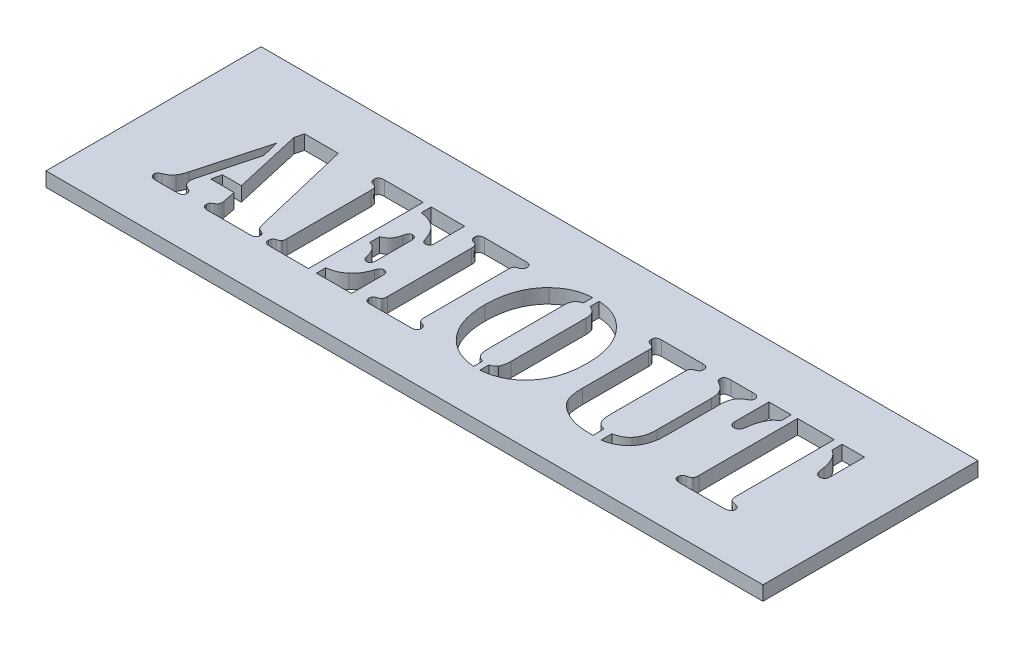
from build123d import *

# Parameters (mm, degrees)
SKETCH1_W           = 50
SKETCH1_H           = 15
BOSS_EXTRUDE1_DEPTH = 1
CUT_EXTRUDE1_REACH  = 28.12


with BuildPart() as part:
    # Sketch1 → Boss-Extrude1 (new body)
    with BuildSketch(Plane(origin=(0, 0, 0), x_dir=(1, 0, 0), z_dir=(0, 1, 0))):
        Rectangle(SKETCH1_W, SKETCH1_H)
    extrude(amount=BOSS_EXTRUDE1_DEPTH)

    # Sketch2 → Cut-Extrude1 (cut, up to next)
    with BuildSketch(Plane(origin=(0, 1, 0), x_dir=(1, 0, 0), z_dir=(0, 1, 0)), mode=Mode.PRIVATE) as cut_extrude1_sk1:
        with BuildLine():
            Line((-18.225694444, 3.752337343), (-15.864583333, 3.752337343))
            Line((-15.864583333, 3.752337343), (-14.223958333, -3.134815435))
            add(Edge.make_bspline(
                [(-14.223958333, -3.134815435), (-14.208128828, -3.191844267), (-14.1779416, -3.300599548), (-14.137358017, -3.405908631), (-14.118055556, -3.455995991)],
                knots=[0, 0, 0, 0, 1.048755183, 2, 2, 2, 2], degree=3))
            add(Edge.make_bspline(
                [(-14.118055556, -3.455995991), (-14.107397122, -3.474656334), (-14.085291097, -3.513358647), (-14.030830987, -3.560564799), (-13.963119074, -3.604018374), (-13.910156126, -3.626377605), (-13.881944444, -3.638287657)],
                knots=[0, 0, 0, 0, 0.840160251, 1.742526606, 2.797515595, 4, 4, 4, 4], degree=3))
            add(Edge.make_bspline(
                [(-13.881944444, -3.638287657), (-13.837688393, -3.657964025), (-13.761778239, -3.691713897), (-13.669036938, -3.758265826), (-13.616162585, -3.844705893), (-13.612860282, -3.908380036), (-13.611111111, -3.942107102)],
                knots=[0, 0, 0, 0, 1.326867952, 2.275909135, 3.086779591, 4, 4, 4, 4], degree=3))
            add(Edge.make_bspline(
                [(-13.611111111, -3.942107102), (-13.612166134, -3.96604148), (-13.614201414, -4.012214079), (-13.637720902, -4.076278339), (-13.675769286, -4.130979021), (-13.729398274, -4.17476108), (-13.797929776, -4.2076827), (-13.879981542, -4.231568272), (-13.977017745, -4.244713365), (-14.046256836, -4.246634121), (-14.083333333, -4.247662657)],
                knots=[0, 0, 0, 0, 0.899652897, 1.735550104, 2.535289427, 3.388132219, 4.315971308, 5.386976564, 6.600765056, 8, 8, 8, 8], degree=3))
            Line((-14.083333333, -4.247662657), (-17.006944444, -4.247662657))
            add(Edge.make_bspline(
                [(-17.006944444, -4.247662657), (-17.034261849, -4.246919978), (-17.087186601, -4.24548111), (-17.161353932, -4.227331168), (-17.228397515, -4.201383662), (-17.285342546, -4.163525658), (-17.331203502, -4.115886242), (-17.365426728, -4.061173841), (-17.384814546, -3.998328838), (-17.387501078, -3.954388943), (-17.388888889, -3.931690435)],
                knots=[0, 0, 0, 0, 1.175318829, 2.277063206, 3.273429624, 4.263211015, 5.198644873, 6.106027898, 7.021610334, 8, 8, 8, 8], degree=3))
            add(Edge.make_bspline(
                [(-17.388888889, -3.931690435), (-17.387792838, -3.896629486), (-17.385842282, -3.834234242), (-17.355488119, -3.760997814), (-17.314163488, -3.716177105), (-17.268869611, -3.682149905), (-17.212493223, -3.641765362), (-17.168123739, -3.616984512), (-17.144097222, -3.603565435)],
                knots=[0, 0, 0, 0, 1.432553572, 2.549404146, 3.155101411, 3.915709373, 4.871335893, 6, 6, 6, 6], degree=3))
            add(Edge.make_bspline(
                [(-17.144097222, -3.603565435), (-17.111697795, -3.583687885), (-17.05336182, -3.547897861), (-16.986135723, -3.475601107), (-16.948113104, -3.388804261), (-16.945720429, -3.326191933), (-16.944444444, -3.292801546)],
                knots=[0, 0, 0, 0, 1.161992046, 2.092195629, 2.982591342, 4, 4, 4, 4], degree=3))
            add(Edge.make_bspline(
                [(-16.944444444, -3.292801546), (-16.944687965, -3.260889836), (-16.945146119, -3.200851902), (-16.955308589, -3.141695398), (-16.960069444, -3.113982102)],
                knots=[0, 0, 0, 0, 1.063051602, 2, 2, 2, 2], degree=3))
            Line((-16.960069444, -3.113982102), (-17.130208333, -2.247662657))
            Line((-17.130208333, -2.247662657), (-18.763888889, -2.247662657))
            Line((-18.763888889, -2.247662657), (-18.605902778, -1.580995991))
            Line((-18.605902778, -1.580995991), (-17.293402778, -1.580995991))
            Line((-17.293402778, -1.580995991), (-18.371527778, 3.169004009))
            Line((-18.371527778, 3.169004009), (-18.225694444, 3.752337343))
        make_face()
    cut_extrude1_tool1 = extrude(cut_extrude1_sk1.sketch, amount=-CUT_EXTRUDE1_REACH, mode=Mode.PRIVATE) & part.part
    # Sketch2 → Cut-Extrude1 (cut, up to next)
    with BuildSketch(Plane(origin=(0, 1, 0), x_dir=(1, 0, 0), z_dir=(0, 1, 0)), mode=Mode.PRIVATE) as cut_extrude1_sk2:
        with BuildLine():
            Line((-18.630208333, 2.241920676), (-18.331597222, 1.023170676))
            Line((-18.331597222, 1.023170676), (-19.34375, -2.744190435))
            add(Edge.make_bspline(
                [(-19.34375, -2.744190435), (-19.356460788, -2.796022226), (-19.380819369, -2.895351151), (-19.386278459, -2.997451428), (-19.388888889, -3.046273769)],
                knots=[0, 0, 0, 0, 1.043639418, 2, 2, 2, 2], degree=3))
            add(Edge.make_bspline(
                [(-19.388888889, -3.046273769), (-19.385926088, -3.103666098), (-19.380268524, -3.213258617), (-19.317470176, -3.362867313), (-19.218609906, -3.488795702), (-19.127257324, -3.54264226), (-19.079861111, -3.570579324)],
                knots=[0, 0, 0, 0, 1.065909191, 2.035388236, 2.980705811, 4, 4, 4, 4], degree=3))
            Line((-19.079861111, -3.570579324), (-18.895833333, -3.664329324))
            add(Edge.make_bspline(
                [(-18.895833333, -3.664329324), (-18.869241129, -3.680263511), (-18.818545475, -3.710640608), (-18.76099582, -3.779513044), (-18.727210262, -3.863412668), (-18.72392285, -3.924430526), (-18.722222222, -3.955995991)],
                knots=[0, 0, 0, 0, 1.03129857, 1.96607825, 2.947821365, 4, 4, 4, 4], degree=3))
            add(Edge.make_bspline(
                [(-18.722222222, -3.955995991), (-18.722771832, -3.978743059), (-18.723823559, -4.022271544), (-18.744235563, -4.082521181), (-18.774090868, -4.134123338), (-18.815171542, -4.178294846), (-18.87097172, -4.208431843), (-18.936579975, -4.231281162), (-19.013943866, -4.244761811), (-19.069391953, -4.246653799), (-19.098958333, -4.247662657)],
                knots=[0, 0, 0, 0, 1.001089615, 1.915671698, 2.776004461, 3.626767041, 4.544209435, 5.547912865, 6.692482548, 8, 8, 8, 8], degree=3))
            Line((-19.098958333, -4.247662657), (-20.586805556, -4.247662657))
            add(Edge.make_bspline(
                [(-20.586805556, -4.247662657), (-20.621039026, -4.246928296), (-20.686526818, -4.24552348), (-20.778824, -4.227776092), (-20.860798396, -4.200378905), (-20.930068661, -4.161063936), (-20.986256718, -4.111053207), (-21.02701359, -4.051695525), (-21.050260512, -3.982475383), (-21.053746987, -3.934175833), (-21.055555556, -3.909120991)],
                knots=[0, 0, 0, 0, 1.263225168, 2.41651886, 3.457937625, 4.444571192, 5.337806274, 6.215550556, 7.074337118, 8, 8, 8, 8], degree=3))
            add(Edge.make_bspline(
                [(-21.055555556, -3.909120991), (-21.052548897, -3.881178015), (-21.046318264, -3.823272382), (-20.990908691, -3.745876531), (-20.907154023, -3.678774154), (-20.837192074, -3.645964232), (-20.798611111, -3.627870991)],
                knots=[0, 0, 0, 0, 0.824400861, 1.708388363, 2.736276122, 4, 4, 4, 4], degree=3))
            add(Edge.make_bspline(
                [(-20.798611111, -3.627870991), (-20.760860497, -3.611393073), (-20.689902515, -3.580420338), (-20.592654058, -3.532585119), (-20.512542357, -3.485342809), (-20.423204393, -3.426106486), (-20.323959349, -3.336761289), (-20.258498117, -3.252298051), (-20.223958333, -3.207732102)],
                knots=[0, 0, 0, 0, 1.026075952, 1.928664772, 2.697596979, 3.341335493, 4.597189607, 6, 6, 6, 6], degree=3))
            add(Edge.make_bspline(
                [(-20.223958333, -3.207732102), (-20.197010421, -3.164830554), (-20.140708623, -3.075197109), (-20.071030349, -2.924348207), (-20.005592556, -2.75543594), (-19.972271372, -2.634019306), (-19.954861111, -2.570579324)],
                knots=[0, 0, 0, 0, 0.874304226, 1.826668352, 2.864437965, 4, 4, 4, 4], degree=3))
            Line((-19.954861111, -2.570579324), (-18.630208333, 2.241920676))
        make_face()
    cut_extrude1_tool2 = extrude(cut_extrude1_sk2.sketch, amount=-CUT_EXTRUDE1_REACH, mode=Mode.PRIVATE) & part.part
    # Sketch2 → Cut-Extrude1 (cut, up to next)
    with BuildSketch(Plane(origin=(0, 1, 0), x_dir=(1, 0, 0), z_dir=(0, 1, 0)), mode=Mode.PRIVATE) as cut_extrude1_sk3:
        with BuildLine():
            Line((-9.944444444, 3.752337343), (-9.944444444, -4.247662657))
            Line((-9.944444444, -4.247662657), (-12.505208333, -4.247662657))
            Line((-12.505208333, -4.247662657), (-12.657986111, -4.247662657))
            add(Edge.make_bspline(
                [(-12.657986111, -4.247662657), (-12.688143193, -4.246664796), (-12.744762942, -4.244791317), (-12.824941968, -4.230915759), (-12.89496513, -4.207581486), (-12.953183411, -4.172182081), (-13.000888301, -4.128326963), (-13.031173102, -4.073084816), (-13.052092292, -4.011289533), (-13.054356757, -3.967189564), (-13.055555556, -3.943843213)],
                knots=[0, 0, 0, 0, 1.275809178, 2.395324508, 3.433364274, 4.378530456, 5.262016052, 6.140052186, 7.015350866, 8, 8, 8, 8], degree=3))
            add(Edge.make_bspline(
                [(-13.055555556, -3.943843213), (-13.053193602, -3.906949739), (-13.048750854, -3.83755445), (-13.00707405, -3.742868654), (-12.93423973, -3.670545575), (-12.871613258, -3.643754728), (-12.838541667, -3.629607102)],
                knots=[0, 0, 0, 0, 1.074896783, 2.021841926, 2.955380476, 4, 4, 4, 4], degree=3))
            add(Edge.make_bspline(
                [(-12.838541667, -3.629607102), (-12.811303725, -3.619882689), (-12.763718359, -3.602893897), (-12.702116774, -3.579379269), (-12.658900449, -3.564371926), (-12.623885908, -3.550885393), (-12.592021729, -3.525409853), (-12.575478532, -3.498968126), (-12.565972222, -3.483773769)],
                knots=[0, 0, 0, 0, 1.641128884, 2.867093284, 3.73955991, 4.239698614, 4.988468111, 6, 6, 6, 6], degree=3))
            add(Edge.make_bspline(
                [(-12.565972222, -3.483773769), (-12.555332805, -3.466197289), (-12.532414193, -3.42833539), (-12.513466583, -3.359193878), (-12.500995269, -3.277659569), (-12.500349778, -3.218795774), (-12.5, -3.186898769)],
                knots=[0, 0, 0, 0, 0.795728394, 1.714096871, 2.761318972, 4, 4, 4, 4], degree=3))
            Line((-12.5, -3.186898769), (-12.5, 2.67074012))
            add(Edge.make_bspline(
                [(-12.5, 2.67074012), (-12.500424065, 2.703200026), (-12.501215224, 2.763759094), (-12.51296161, 2.847192864), (-12.532833177, 2.917739985), (-12.55537144, 2.956383664), (-12.565972222, 2.974559565)],
                knots=[0, 0, 0, 0, 1.234380862, 2.302932019, 3.201790819, 4, 4, 4, 4], degree=3))
            add(Edge.make_bspline(
                [(-12.565972222, 2.974559565), (-12.575483595, 2.989740572), (-12.592035603, 3.016159066), (-12.623852028, 3.041760524), (-12.659199933, 3.054949733), (-12.701606165, 3.072666363), (-12.763844302, 3.095084235), (-12.811349572, 3.112283895), (-12.838541667, 3.122129009)],
                knots=[0, 0, 0, 0, 1.009569614, 1.75688657, 2.256055053, 3.138468602, 4.362054748, 6, 6, 6, 6], degree=3))
            add(Edge.make_bspline(
                [(-12.838541667, 3.122129009), (-12.871801909, 3.136091116), (-12.935557287, 3.162854584), (-13.006590806, 3.239066523), (-13.048844372, 3.335231949), (-13.053226552, 3.405803045), (-13.055555556, 3.443309565)],
                knots=[0, 0, 0, 0, 1.03007389, 1.974512116, 2.923511095, 4, 4, 4, 4], degree=3))
            add(Edge.make_bspline(
                [(-13.055555556, 3.443309565), (-13.054328704, 3.467217355), (-13.05200922, 3.512417369), (-13.0315862, 3.575588307), (-13.000839034, 3.631222049), (-12.953238635, 3.675245873), (-12.894605898, 3.71011003), (-12.825355701, 3.736155963), (-12.74469749, 3.749286745), (-12.688120446, 3.751277185), (-12.657986111, 3.752337343)],
                knots=[0, 0, 0, 0, 1.002003185, 1.894384998, 2.766311233, 3.643649008, 4.582238159, 5.621343591, 6.733068665, 8, 8, 8, 8], degree=3))
            Line((-12.657986111, 3.752337343), (-12.505208333, 3.752337343))
            Line((-12.505208333, 3.752337343), (-9.944444444, 3.752337343))
        make_face()
    cut_extrude1_tool3 = extrude(cut_extrude1_sk3.sketch, amount=-CUT_EXTRUDE1_REACH, mode=Mode.PRIVATE) & part.part
    # Sketch2 → Cut-Extrude1 (cut, up to next)
    with BuildSketch(Plane(origin=(0, 1, 0), x_dir=(1, 0, 0), z_dir=(0, 1, 0)), mode=Mode.PRIVATE) as cut_extrude1_sk4:
        with BuildLine():
            Line((-9.388888889, 3.752337343), (-7.055555556, 3.752337343))
            Line((-7.055555556, 3.752337343), (-7.055555556, 1.646434565))
            add(Edge.make_bspline(
                [(-7.055555556, 1.646434565), (-7.055669567, 1.618544656), (-7.055880387, 1.566973429), (-7.071223359, 1.496087701), (-7.090260791, 1.435351653), (-7.122426428, 1.387027877), (-7.164331142, 1.350182432), (-7.216402946, 1.326689704), (-7.277334945, 1.309975431), (-7.321619833, 1.308622193), (-7.345486111, 1.307892898)],
                knots=[0, 0, 0, 0, 1.297100046, 2.398467488, 3.37194797, 4.248080405, 5.071011418, 5.940462097, 6.890061477, 8, 8, 8, 8], degree=3))
            add(Edge.make_bspline(
                [(-7.345486111, 1.307892898), (-7.382088862, 1.310144587), (-7.447045154, 1.314140498), (-7.525089124, 1.346616979), (-7.5615549, 1.397228037), (-7.590091978, 1.445024255), (-7.61688211, 1.507059526), (-7.632337925, 1.553712116), (-7.640625, 1.578726231)],
                knots=[0, 0, 0, 0, 1.496408907, 2.655570162, 3.259085196, 3.998612629, 4.926899124, 6, 6, 6, 6], degree=3))
            add(Edge.make_bspline(
                [(-7.640625, 1.578726231), (-7.679101718, 1.687438169), (-7.752934914, 1.896046133), (-7.901792924, 2.181290392), (-8.077461827, 2.425123302), (-8.281051934, 2.629636566), (-8.513130684, 2.795363033), (-8.777344862, 2.920718499), (-9.071384994, 3.012555062), (-9.280623281, 3.041289041), (-9.388888889, 3.056156787)],
                knots=[0, 0, 0, 0, 1.130832012, 2.169960077, 3.145894403, 4.069657363, 4.990096479, 5.930045021, 6.928948727, 8, 8, 8, 8], degree=3))
            Line((-9.388888889, 3.056156787), (-9.388888889, 3.752337343))
        make_face()
    cut_extrude1_tool4 = extrude(cut_extrude1_sk4.sketch, amount=-CUT_EXTRUDE1_REACH, mode=Mode.PRIVATE) & part.part
    # Sketch2 → Cut-Extrude1 (cut, up to next)
    with BuildSketch(Plane(origin=(0, 1, 0), x_dir=(1, 0, 0), z_dir=(0, 1, 0)), mode=Mode.PRIVATE) as cut_extrude1_sk5:
        with BuildLine():
            Line((-9.388888889, -0.534120991), (-9.388888889, 0.141226231))
            add(Edge.make_bspline(
                [(-9.388888889, 0.141226231), (-9.337663562, 0.169012539), (-9.239745776, 0.222126376), (-9.104642667, 0.306874839), (-8.994479143, 0.40095336), (-8.900277875, 0.49734002), (-8.825986528, 0.608310942), (-8.76156496, 0.731334748), (-8.709662221, 0.871611583), (-8.684785362, 0.971389076), (-8.671875, 1.023170676)],
                knots=[0, 0, 0, 0, 1.180986571, 2.257469038, 3.222785507, 4.110265038, 4.978639913, 5.917385587, 6.919184056, 8, 8, 8, 8], degree=3))
            add(Edge.make_bspline(
                [(-8.671875, 1.023170676), (-8.664441851, 1.058069157), (-8.650789917, 1.122164703), (-8.622455961, 1.208630571), (-8.592887843, 1.278436433), (-8.556640876, 1.33259004), (-8.513484775, 1.371893933), (-8.463999016, 1.400692582), (-8.406017826, 1.416419717), (-8.365255173, 1.418111483), (-8.34375, 1.419004009)],
                knots=[0, 0, 0, 0, 1.505392146, 2.764846178, 3.836585285, 4.697326174, 5.492824879, 6.280783141, 7.092991927, 8, 8, 8, 8], degree=3))
            add(Edge.make_bspline(
                [(-8.34375, 1.419004009), (-8.31563229, 1.417896416), (-8.262191812, 1.415791327), (-8.190134354, 1.384714698), (-8.132135351, 1.334961595), (-8.108060143, 1.290949197), (-8.095486111, 1.267962343)],
                knots=[0, 0, 0, 0, 1.085852217, 2.06376913, 2.988742716, 4, 4, 4, 4], degree=3))
            add(Edge.make_bspline(
                [(-8.095486111, 1.267962343), (-8.089102873, 1.25075223), (-8.073726289, 1.209294787), (-8.0649093, 1.131517327), (-8.054893485, 1.030391616), (-8.055318882, 0.954360403), (-8.055555556, 0.912059565)],
                knots=[0, 0, 0, 0, 0.609895254, 1.469176849, 2.591947466, 4, 4, 4, 4], degree=3))
            Line((-8.055555556, 0.912059565), (-8.055555556, -1.308426546))
            add(Edge.make_bspline(
                [(-8.055555556, -1.308426546), (-8.056167113, -1.351260959), (-8.057293263, -1.430138161), (-8.066480582, -1.538494172), (-8.084857116, -1.625495974), (-8.110040824, -1.694197657), (-8.148478957, -1.744194256), (-8.198656301, -1.779082379), (-8.261174674, -1.800008749), (-8.307119316, -1.802102648), (-8.331597222, -1.803218213)],
                knots=[0, 0, 0, 0, 1.58411055, 2.917051989, 4.012593196, 4.866950163, 5.598911493, 6.305405458, 7.097171608, 8, 8, 8, 8], degree=3))
            add(Edge.make_bspline(
                [(-8.331597222, -1.803218213), (-8.371352522, -1.799775024), (-8.447235194, -1.79320286), (-8.529637331, -1.736486357), (-8.574249419, -1.670847199), (-8.604821291, -1.607984142), (-8.633160699, -1.531923128), (-8.647026731, -1.475854411), (-8.654513889, -1.445579324)],
                knots=[0, 0, 0, 0, 1.342036637, 2.56160375, 3.240040044, 4.033620071, 4.938225671, 6, 6, 6, 6], degree=3))
            add(Edge.make_bspline(
                [(-8.654513889, -1.445579324), (-8.670496289, -1.381495148), (-8.70103125, -1.259059983), (-8.766150056, -1.091010523), (-8.837561431, -0.94414316), (-8.924135219, -0.822473526), (-9.021373899, -0.721331324), (-9.1301855, -0.638090293), (-9.25384843, -0.574447183), (-9.343226627, -0.547756794), (-9.388888889, -0.534120991)],
                knots=[0, 0, 0, 0, 1.278531199, 2.442680666, 3.485773606, 4.434753066, 5.322955403, 6.195374153, 7.078038041, 8, 8, 8, 8], degree=3))
        make_face()
    cut_extrude1_tool5 = extrude(cut_extrude1_sk5.sketch, amount=-CUT_EXTRUDE1_REACH, mode=Mode.PRIVATE) & part.part
    # Sketch2 → Cut-Extrude1 (cut, up to next)
    with BuildSketch(Plane(origin=(0, 1, 0), x_dir=(1, 0, 0), z_dir=(0, 1, 0)), mode=Mode.PRIVATE) as cut_extrude1_sk6:
        with BuildLine():
            Line((-9.388888889, -4.247662657), (-9.388888889, -3.601829324))
            add(Edge.make_bspline(
                [(-9.388888889, -3.601829324), (-9.328033322, -3.591350976), (-9.211008251, -3.571201143), (-9.044206003, -3.533981585), (-8.894426509, -3.488061771), (-8.756679237, -3.438362448), (-8.629526986, -3.372942752), (-8.502986676, -3.29802069), (-8.3773169, -3.208133556), (-8.29642167, -3.140008777), (-8.255208333, -3.105301546)],
                knots=[0, 0, 0, 0, 1.178424117, 2.266106011, 3.258322885, 4.167001624, 5.056005255, 5.982165939, 6.971982955, 8, 8, 8, 8], degree=3))
            add(Edge.make_bspline(
                [(-8.255208333, -3.105301546), (-8.177009754, -3.032324578), (-8.027712197, -2.892996176), (-7.874612383, -2.689183423), (-7.773828925, -2.51541869), (-7.70295545, -2.367371088), (-7.631660786, -2.202144093), (-7.589578191, -2.083583063), (-7.567708333, -2.021968213)],
                knots=[0, 0, 0, 0, 1.478913818, 2.823557948, 3.509390326, 4.258413643, 5.094916917, 6, 6, 6, 6], degree=3))
            add(Edge.make_bspline(
                [(-7.567708333, -2.021968213), (-7.557073747, -1.992322384), (-7.537431592, -1.937566334), (-7.5051396, -1.863659638), (-7.470559621, -1.805951792), (-7.424508077, -1.748103256), (-7.345774263, -1.700067023), (-7.275054495, -1.694851242), (-7.237847222, -1.692107102)],
                knots=[0, 0, 0, 0, 1.119865357, 2.068399023, 2.86239926, 3.505232302, 4.687446157, 6, 6, 6, 6], degree=3))
            add(Edge.make_bspline(
                [(-7.237847222, -1.692107102), (-7.21232285, -1.693620145), (-7.164656008, -1.696445757), (-7.098178772, -1.712299176), (-7.045385997, -1.745158163), (-7.004538366, -1.79143868), (-6.977684976, -1.854024198), (-6.956887466, -1.931639231), (-6.945738072, -2.027451338), (-6.944897939, -2.097177841), (-6.944444444, -2.134815435)],
                knots=[0, 0, 0, 0, 0.999578033, 1.866714988, 2.638932701, 3.392362113, 4.242509345, 5.27434009, 6.528718957, 8, 8, 8, 8], degree=3))
            Line((-6.944444444, -2.134815435), (-6.944444444, -4.247662657))
            Line((-6.944444444, -4.247662657), (-9.388888889, -4.247662657))
        make_face()
    cut_extrude1_tool6 = extrude(cut_extrude1_sk6.sketch, amount=-CUT_EXTRUDE1_REACH, mode=Mode.PRIVATE) & part.part
    # Sketch2 → Cut-Extrude1 (cut, up to next)
    with BuildSketch(Plane(origin=(0, 1, 0), x_dir=(1, 0, 0), z_dir=(0, 1, 0)), mode=Mode.PRIVATE) as cut_extrude1_sk7:
        with BuildLine():
            Line((-2.939236111, -4.247662657), (-5.505208333, -4.247662657))
            Line((-5.505208333, -4.247662657), (-5.657986111, -4.247662657))
            add(Edge.make_bspline(
                [(-5.657986111, -4.247662657), (-5.688143193, -4.246664796), (-5.744762942, -4.244791317), (-5.824941968, -4.230915759), (-5.89496513, -4.207581486), (-5.953183411, -4.172182081), (-6.000888301, -4.128326963), (-6.031173102, -4.073084816), (-6.052092292, -4.011289533), (-6.054356757, -3.967189564), (-6.055555556, -3.943843213)],
                knots=[0, 0, 0, 0, 1.275809178, 2.395324508, 3.433364274, 4.378530456, 5.262016052, 6.140052186, 7.015350866, 8, 8, 8, 8], degree=3))
            add(Edge.make_bspline(
                [(-6.055555556, -3.943843213), (-6.053193602, -3.906949739), (-6.048750854, -3.83755445), (-6.00707405, -3.742868654), (-5.93423973, -3.670545575), (-5.871613258, -3.643754728), (-5.838541667, -3.629607102)],
                knots=[0, 0, 0, 0, 1.074896783, 2.021841926, 2.955380476, 4, 4, 4, 4], degree=3))
            add(Edge.make_bspline(
                [(-5.838541667, -3.629607102), (-5.811303725, -3.619882689), (-5.763718359, -3.602893897), (-5.702116774, -3.579379269), (-5.658900449, -3.564371926), (-5.623885908, -3.550885393), (-5.592021729, -3.525409853), (-5.575478532, -3.498968126), (-5.565972222, -3.483773769)],
                knots=[0, 0, 0, 0, 1.641128884, 2.867093284, 3.73955991, 4.239698614, 4.988468111, 6, 6, 6, 6], degree=3))
            add(Edge.make_bspline(
                [(-5.565972222, -3.483773769), (-5.555332805, -3.466197289), (-5.532414193, -3.42833539), (-5.513466583, -3.359193878), (-5.500995269, -3.277659569), (-5.500349778, -3.218795774), (-5.5, -3.186898769)],
                knots=[0, 0, 0, 0, 0.795728394, 1.714096871, 2.761318972, 4, 4, 4, 4], degree=3))
            Line((-5.5, -3.186898769), (-5.5, 2.67074012))
            add(Edge.make_bspline(
                [(-5.5, 2.67074012), (-5.500424065, 2.703200026), (-5.501215224, 2.763759094), (-5.51296161, 2.847192864), (-5.532833177, 2.917739985), (-5.55537144, 2.956383664), (-5.565972222, 2.974559565)],
                knots=[0, 0, 0, 0, 1.234380862, 2.302932019, 3.201790819, 4, 4, 4, 4], degree=3))
            add(Edge.make_bspline(
                [(-5.565972222, 2.974559565), (-5.575483595, 2.989740572), (-5.592035603, 3.016159066), (-5.623852028, 3.041760524), (-5.659199933, 3.054949733), (-5.701606165, 3.072666363), (-5.763844302, 3.095084235), (-5.811349572, 3.112283895), (-5.838541667, 3.122129009)],
                knots=[0, 0, 0, 0, 1.009569614, 1.75688657, 2.256055053, 3.138468602, 4.362054748, 6, 6, 6, 6], degree=3))
            add(Edge.make_bspline(
                [(-5.838541667, 3.122129009), (-5.871801909, 3.136091116), (-5.935557287, 3.162854584), (-6.006590806, 3.239066523), (-6.048844372, 3.335231949), (-6.053226552, 3.405803045), (-6.055555556, 3.443309565)],
                knots=[0, 0, 0, 0, 1.03007389, 1.974512116, 2.923511095, 4, 4, 4, 4], degree=3))
            add(Edge.make_bspline(
                [(-6.055555556, 3.443309565), (-6.054328704, 3.467217355), (-6.05200922, 3.512417369), (-6.0315862, 3.575588307), (-6.000839034, 3.631222049), (-5.953238635, 3.675245873), (-5.894605898, 3.71011003), (-5.825355701, 3.736155963), (-5.74469749, 3.749286745), (-5.688120446, 3.751277185), (-5.657986111, 3.752337343)],
                knots=[0, 0, 0, 0, 1.002003185, 1.894384998, 2.766311233, 3.643649008, 4.582238159, 5.621343591, 6.733068665, 8, 8, 8, 8], degree=3))
            Line((-5.657986111, 3.752337343), (-5.505208333, 3.752337343))
            Line((-5.505208333, 3.752337343), (-2.939236111, 3.752337343))
            Line((-2.939236111, 3.752337343), (-2.786458333, 3.752337343))
            add(Edge.make_bspline(
                [(-2.786458333, 3.752337343), (-2.756335548, 3.751248786), (-2.699780188, 3.749205026), (-2.619515239, 3.736514149), (-2.551209673, 3.709644803), (-2.492787581, 3.675369077), (-2.445612006, 3.63071419), (-2.412495338, 3.576148005), (-2.392565872, 3.512338372), (-2.390160938, 3.467190026), (-2.388888889, 3.443309565)],
                knots=[0, 0, 0, 0, 1.268560657, 2.381715452, 3.39938894, 4.339185152, 5.217651218, 6.10317875, 6.996708201, 8, 8, 8, 8], degree=3))
            add(Edge.make_bspline(
                [(-2.388888889, 3.443309565), (-2.391217892, 3.405803045), (-2.395600072, 3.335231949), (-2.437853638, 3.239066523), (-2.508887157, 3.162854584), (-2.572642536, 3.136091116), (-2.605902778, 3.122129009)],
                knots=[0, 0, 0, 0, 1.076488905, 2.025487884, 2.96992611, 4, 4, 4, 4], degree=3))
            add(Edge.make_bspline(
                [(-2.605902778, 3.122129009), (-2.633108255, 3.112323923), (-2.680636906, 3.095194192), (-2.743251426, 3.072202444), (-2.786443889, 3.055153026), (-2.822057249, 3.042101945), (-2.85235035, 3.015396386), (-2.868850508, 2.989601374), (-2.878472222, 2.974559565)],
                knots=[0, 0, 0, 0, 1.636602956, 2.859186374, 3.771360974, 4.270120389, 4.991257728, 6, 6, 6, 6], degree=3))
            add(Edge.make_bspline(
                [(-2.878472222, 2.974559565), (-2.889256679, 2.956433734), (-2.912101279, 2.918037979), (-2.928610034, 2.846662772), (-2.944134899, 2.764020836), (-2.944336529, 2.703260101), (-2.944444444, 2.67074012)],
                knots=[0, 0, 0, 0, 0.798774196, 1.692034923, 2.764745377, 4, 4, 4, 4], degree=3))
            Line((-2.944444444, 2.67074012), (-2.944444444, -3.186898769))
            add(Edge.make_bspline(
                [(-2.944444444, -3.186898769), (-2.944415357, -3.218857999), (-2.944361594, -3.277930064), (-2.928115398, -3.35866204), (-2.912511028, -3.428630488), (-2.889291505, -3.466246398), (-2.878472222, -3.483773769)],
                knots=[0, 0, 0, 0, 1.239531227, 2.291096129, 3.203725438, 4, 4, 4, 4], degree=3))
            add(Edge.make_bspline(
                [(-2.878472222, -3.483773769), (-2.868855171, -3.498828382), (-2.852363009, -3.524645352), (-2.82202721, -3.551233664), (-2.786731542, -3.564572957), (-2.74276656, -3.578932233), (-2.680754025, -3.602992966), (-2.63315089, -3.619918754), (-2.605902778, -3.629607102)],
                knots=[0, 0, 0, 0, 1.010634903, 1.733125261, 2.232820463, 3.135449138, 4.360326402, 6, 6, 6, 6], degree=3))
            add(Edge.make_bspline(
                [(-2.605902778, -3.629607102), (-2.572831187, -3.643754728), (-2.510204715, -3.670545575), (-2.437370394, -3.742868654), (-2.395693591, -3.83755445), (-2.391250842, -3.906949739), (-2.388888889, -3.943843213)],
                knots=[0, 0, 0, 0, 1.044619524, 1.978158074, 2.925103217, 4, 4, 4, 4], degree=3))
            add(Edge.make_bspline(
                [(-2.388888889, -3.943843213), (-2.390131332, -3.967163212), (-2.392478238, -4.011213401), (-2.412924361, -4.073635506), (-2.445563328, -4.127819507), (-2.49284453, -4.172302641), (-2.550838814, -4.207122042), (-2.619942411, -4.231265637), (-2.699711534, -4.244713645), (-2.756311689, -4.246637803), (-2.786458333, -4.247662657)],
                knots=[0, 0, 0, 0, 0.985947552, 1.862400454, 2.754162249, 3.638812863, 4.585225398, 5.601516872, 6.722508463, 8, 8, 8, 8], degree=3))
            Line((-2.786458333, -4.247662657), (-2.939236111, -4.247662657))
        make_face()
    cut_extrude1_tool7 = extrude(cut_extrude1_sk7.sketch, amount=-CUT_EXTRUDE1_REACH, mode=Mode.PRIVATE) & part.part
    # Sketch2 → Cut-Extrude1 (cut, up to next)
    with BuildSketch(Plane(origin=(0, 1, 0), x_dir=(1, 0, 0), z_dir=(0, 1, 0)), mode=Mode.PRIVATE) as cut_extrude1_sk8:
        with BuildLine():
            add(Edge.make_bspline(
                [(1.722222222, 3.271434565), (1.674818758, 3.25294336), (1.58511467, 3.217951474), (1.46477519, 3.149609924), (1.366483415, 3.071534569), (1.287260099, 2.982239009), (1.23282966, 2.873679039), (1.192925637, 2.747895761), (1.17184617, 2.599659682), (1.168468154, 2.494292997), (1.166666667, 2.438101231)],
                knots=[0, 0, 0, 0, 1.118377415, 2.116364868, 3.030964595, 3.870538326, 4.719041391, 5.681309848, 6.763448884, 8, 8, 8, 8], degree=3))
            Line((1.166666667, 2.438101231), (1.166666667, -2.789329324))
            add(Edge.make_bspline(
                [(1.166666667, -2.789329324), (1.16774704, -2.868770211), (1.169742422, -3.015492575), (1.198208433, -3.216484305), (1.237849346, -3.383131065), (1.288155875, -3.472931071), (1.310763889, -3.513287657)],
                knots=[0, 0, 0, 0, 1.27427824, 2.353512468, 3.260059993, 4, 4, 4, 4], degree=3))
            add(Edge.make_bspline(
                [(1.310763889, -3.513287657), (1.332188049, -3.541025573), (1.377200811, -3.599303713), (1.472217286, -3.66795105), (1.589176506, -3.723432236), (1.676056669, -3.749458219), (1.722222222, -3.763287657)],
                knots=[0, 0, 0, 0, 0.851726799, 1.789501929, 2.825406619, 4, 4, 4, 4], degree=3))
            Line((1.722222222, -3.763287657), (1.722222222, -4.403912657))
            add(Edge.make_bspline(
                [(1.722222222, -4.403912657), (1.615479929, -4.393008656), (1.404694929, -4.371476423), (1.096912236, -4.307898808), (0.80213072, -4.221573863), (0.521518083, -4.109184333), (0.252876981, -3.975960183), (-0.001395008, -3.816833788), (-0.243027157, -3.634164417), (-0.390691875, -3.49502549), (-0.465277778, -3.424745991)],
                knots=[0, 0, 0, 0, 1.051385509, 2.076180753, 3.076110661, 4.059092477, 5.035964268, 6.012044883, 6.995877765, 8, 8, 8, 8], degree=3))
            add(Edge.make_bspline(
                [(-0.465277778, -3.424745991), (-0.557358312, -3.327232299), (-0.740930064, -3.132829003), (-0.97450573, -2.803895301), (-1.171008841, -2.447499113), (-1.333281389, -2.063615234), (-1.457859985, -1.650774029), (-1.547300932, -1.210894968), (-1.602277263, -0.742691654), (-1.60811256, -0.42142877), (-1.611111111, -0.256343213)],
                knots=[0, 0, 0, 0, 0.929101366, 1.852256478, 2.788058139, 3.746505495, 4.736611211, 5.773063896, 6.855656831, 8, 8, 8, 8], degree=3))
            add(Edge.make_bspline(
                [(-1.611111111, -0.256343213), (-1.607650443, -0.090076074), (-1.60087639, 0.235382011), (-1.541876712, 0.710408248), (-1.449276927, 1.161091707), (-1.317557278, 1.585935799), (-1.147927502, 1.983409526), (-0.939017802, 2.349491303), (-0.699642001, 2.689692057), (-0.507413583, 2.886656757), (-0.411458333, 2.984976231)],
                knots=[0, 0, 0, 0, 1.123125173, 2.198451065, 3.229210727, 4.228575418, 5.199030772, 6.142910105, 7.072990733, 8, 8, 8, 8], degree=3))
            add(Edge.make_bspline(
                [(-0.411458333, 2.984976231), (-0.335662166, 3.055205954), (-0.186475907, 3.193436026), (0.054144644, 3.374311197), (0.303628259, 3.528074862), (0.562882314, 3.655900901), (0.832918415, 3.759196585), (1.11688876, 3.83531157), (1.414360025, 3.888321601), (1.618426727, 3.902905547), (1.722222222, 3.910323454)],
                knots=[0, 0, 0, 0, 1.041191674, 2.049331728, 3.02892685, 3.991699427, 4.959285675, 5.938654922, 6.951527461, 8, 8, 8, 8], degree=3))
            Line((1.722222222, 3.910323454), (1.722222222, 3.271434565))
        make_face()
    cut_extrude1_tool8 = extrude(cut_extrude1_sk8.sketch, amount=-CUT_EXTRUDE1_REACH, mode=Mode.PRIVATE) & part.part
    # Sketch2 → Cut-Extrude1 (cut, up to next)
    with BuildSketch(Plane(origin=(0, 1, 0), x_dir=(1, 0, 0), z_dir=(0, 1, 0)), mode=Mode.PRIVATE) as cut_extrude1_sk9:
        with BuildLine():
            Line((2.166666667, 3.271434565), (2.166666667, 3.910323454))
            add(Edge.make_bspline(
                [(2.166666667, 3.910323454), (2.270474384, 3.902964759), (2.473996227, 3.888537556), (2.771293149, 3.834779035), (3.055524667, 3.759631774), (3.326351408, 3.655406332), (3.58667511, 3.52860077), (3.836446884, 3.374241242), (4.077109699, 3.193454401), (4.226290128, 3.055212145), (4.302083333, 2.984976231)],
                knots=[0, 0, 0, 0, 1.04780179, 2.054284169, 3.038654616, 4.005621862, 4.973010873, 5.95197931, 6.959474417, 8, 8, 8, 8], degree=3))
            add(Edge.make_bspline(
                [(4.302083333, 2.984976231), (4.398416238, 2.885351542), (4.590769239, 2.686425658), (4.833360167, 2.347515173), (5.038835094, 1.981851902), (5.210655444, 1.589990405), (5.339885643, 1.167852694), (5.433305314, 0.718698431), (5.489315807, 0.24044015), (5.496374926, -0.087788019), (5.5, -0.256343213)],
                knots=[0, 0, 0, 0, 0.935258746, 1.86748057, 2.805880446, 3.76541513, 4.752258028, 5.782852375, 6.861426953, 8, 8, 8, 8], degree=3))
            add(Edge.make_bspline(
                [(5.5, -0.256343213), (5.497006578, -0.42143105), (5.491181263, -0.74269837), (5.436134163, -1.210870229), (5.346944296, -1.650860892), (5.221550576, -2.063095826), (5.062416855, -2.448434565), (4.863004412, -2.80339851), (4.629953338, -3.132373525), (4.447360398, -3.327173887), (4.355902778, -3.424745991)],
                knots=[0, 0, 0, 0, 1.144670239, 2.227572595, 3.264321513, 4.254710215, 5.211875763, 6.149896407, 7.07331537, 8, 8, 8, 8], degree=3))
            add(Edge.make_bspline(
                [(4.355902778, -3.424745991), (4.281427395, -3.495738997), (4.134258297, -3.636026649), (3.891422432, -3.818216847), (3.63833154, -3.979802171), (3.368981599, -4.112370721), (3.088840058, -4.225628738), (2.793358503, -4.308939342), (2.485535116, -4.373957163), (2.27402561, -4.393827024), (2.166666667, -4.403912657)],
                knots=[0, 0, 0, 0, 1.006659813, 1.989237384, 2.967081666, 3.942707027, 4.924434617, 5.92149591, 6.944983577, 8, 8, 8, 8], degree=3))
            Line((2.166666667, -4.403912657), (2.166666667, -3.763287657))
            add(Edge.make_bspline(
                [(2.166666667, -3.763287657), (2.212900025, -3.751616256), (2.296073944, -3.730619376), (2.406491501, -3.678482883), (2.49400827, -3.605181744), (2.53884022, -3.545031546), (2.5625, -3.513287657)],
                knots=[0, 0, 0, 0, 1.186680144, 2.134840347, 3.015673713, 4, 4, 4, 4], degree=3))
            add(Edge.make_bspline(
                [(2.5625, -3.513287657), (2.587363945, -3.468901683), (2.640401786, -3.37422096), (2.688117017, -3.205119906), (2.716906436, -3.007376241), (2.720370928, -2.865267112), (2.722222222, -2.789329324)],
                knots=[0, 0, 0, 0, 0.810910452, 1.729771362, 2.786874963, 4, 4, 4, 4], degree=3))
            Line((2.722222222, -2.789329324), (2.722222222, 2.438101231))
            add(Edge.make_bspline(
                [(2.722222222, 2.438101231), (2.720874307, 2.487942615), (2.718308602, 2.582813804), (2.699676503, 2.716873876), (2.668145968, 2.835869903), (2.633099634, 2.90500117), (2.616319444, 2.938101231)],
                knots=[0, 0, 0, 0, 1.157578965, 2.203407792, 3.139791374, 4, 4, 4, 4], degree=3))
            add(Edge.make_bspline(
                [(2.616319444, 2.938101231), (2.59181618, 2.976321408), (2.544935464, 3.049445919), (2.447548211, 3.141270389), (2.319325739, 3.21286032), (2.221674838, 3.250328305), (2.166666667, 3.271434565)],
                knots=[0, 0, 0, 0, 0.947326719, 1.812466874, 2.767730825, 4, 4, 4, 4], degree=3))
        make_face()
    cut_extrude1_tool9 = extrude(cut_extrude1_sk9.sketch, amount=-CUT_EXTRUDE1_REACH, mode=Mode.PRIVATE) & part.part
    # Sketch2 → Cut-Extrude1 (cut, up to next)
    with BuildSketch(Plane(origin=(0, 1, 0), x_dir=(1, 0, 0), z_dir=(0, 1, 0)), mode=Mode.PRIVATE) as cut_extrude1_sk10:
        with BuildLine():
            Line((6.833333333, -1.921273769), (6.833333333, 2.67074012))
            add(Edge.make_bspline(
                [(6.833333333, 2.67074012), (6.832909269, 2.703200026), (6.832118109, 2.763759094), (6.820371723, 2.847192864), (6.800500156, 2.917739985), (6.777961894, 2.956383664), (6.767361111, 2.974559565)],
                knots=[0, 0, 0, 0, 1.234380862, 2.302932019, 3.201790819, 4, 4, 4, 4], degree=3))
            add(Edge.make_bspline(
                [(6.767361111, 2.974559565), (6.757849738, 2.989740572), (6.74129773, 3.016159066), (6.709481305, 3.041760524), (6.674133401, 3.054949733), (6.631727168, 3.072666363), (6.569489032, 3.095084235), (6.521983761, 3.112283895), (6.494791667, 3.122129009)],
                knots=[0, 0, 0, 0, 1.009569614, 1.75688657, 2.256055053, 3.138468602, 4.362054748, 6, 6, 6, 6], degree=3))
            add(Edge.make_bspline(
                [(6.494791667, 3.122129009), (6.461616191, 3.136177719), (6.398410493, 3.16294323), (6.326774529, 3.23707557), (6.284482335, 3.331715404), (6.28010497, 3.401174066), (6.277777778, 3.438101231)],
                knots=[0, 0, 0, 0, 1.041483567, 1.98422766, 2.928330066, 4, 4, 4, 4], degree=3))
            add(Edge.make_bspline(
                [(6.277777778, 3.438101231), (6.279082007, 3.462540489), (6.281549904, 3.508785089), (6.300940986, 3.57400115), (6.335058464, 3.62956663), (6.382959904, 3.675469008), (6.443709189, 3.709552302), (6.514168197, 3.73679427), (6.596817903, 3.749028537), (6.65507285, 3.751195631), (6.685763889, 3.752337343)],
                knots=[0, 0, 0, 0, 1.002726072, 1.897384446, 2.761532256, 3.652394326, 4.589906903, 5.605228772, 6.738338646, 8, 8, 8, 8], degree=3))
            Line((6.685763889, 3.752337343), (6.828125, 3.752337343))
            Line((6.828125, 3.752337343), (9.394097222, 3.752337343))
            Line((9.394097222, 3.752337343), (9.546875, 3.752337343))
            Line((9.546875, 3.752337343), (9.758680556, 3.728031787))
            add(Edge.make_bspline(
                [(9.758680556, 3.728031787), (9.784799314, 3.715812787), (9.837962845, 3.690941575), (9.895865297, 3.621086563), (9.939885638, 3.535897949), (9.942878424, 3.470556186), (9.944444444, 3.43636512)],
                knots=[0, 0, 0, 0, 0.92965803, 1.892276139, 2.897101623, 4, 4, 4, 4], degree=3))
            add(Edge.make_bspline(
                [(9.944444444, 3.43636512), (9.942045464, 3.400029737), (9.937499536, 3.331176292), (9.895447964, 3.237076497), (9.823811654, 3.16294297), (9.760606005, 3.13617763), (9.727430556, 3.122129009)],
                knots=[0, 0, 0, 0, 1.059364441, 2.007434175, 2.954139888, 4, 4, 4, 4], degree=3))
            add(Edge.make_bspline(
                [(9.727430556, 3.122129009), (9.700121668, 3.112592062), (9.652215739, 3.095862113), (9.590424865, 3.070154772), (9.546872069, 3.053461933), (9.51128127, 3.040352399), (9.480980798, 3.013665937), (9.46448202, 2.987867349), (9.454861111, 2.972823454)],
                knots=[0, 0, 0, 0, 1.633395197, 2.865342401, 3.775729129, 4.273510971, 4.993234874, 6, 6, 6, 6], degree=3))
            add(Edge.make_bspline(
                [(9.454861111, 2.972823454), (9.444051376, 2.955294248), (9.420852345, 2.917674402), (9.404814053, 2.846615576), (9.389169721, 2.764035768), (9.388986794, 2.703265306), (9.388888889, 2.67074012)],
                knots=[0, 0, 0, 0, 0.783173522, 1.680787416, 2.758725557, 4, 4, 4, 4], degree=3))
            Line((9.388888889, 2.67074012), (9.388888889, -2.230301546))
            add(Edge.make_bspline(
                [(9.388888889, -2.230301546), (9.38904332, -2.307280241), (9.38932552, -2.447947398), (9.395537952, -2.640602911), (9.400187254, -2.795453639), (9.41619459, -2.94901668), (9.446919147, -3.110459134), (9.498875277, -3.223556425), (9.524305556, -3.278912657)],
                knots=[0, 0, 0, 0, 1.297880407, 2.371684116, 3.250791199, 3.908150793, 4.976130288, 6, 6, 6, 6], degree=3))
            add(Edge.make_bspline(
                [(9.524305556, -3.278912657), (9.54906377, -3.321770997), (9.594517943, -3.400455604), (9.674407198, -3.48326609), (9.755730382, -3.528086287), (9.835640061, -3.561006381), (9.935207746, -3.600396638), (10.009650659, -3.623772432), (10.050347222, -3.636551546)],
                knots=[0, 0, 0, 0, 1.349479507, 2.477540353, 3.078975584, 3.871221815, 4.836236359, 6, 6, 6, 6], degree=3))
            Line((10.050347222, -3.636551546), (10.050347222, -4.403912657))
            Line((10.050347222, -4.403912657), (9.921875, -4.403912657))
            add(Edge.make_bspline(
                [(9.921875, -4.403912657), (9.802029904, -4.402292044), (9.573070431, -4.399195924), (9.245007701, -4.374726499), (8.947880708, -4.336086468), (8.763017192, -4.291416472), (8.675347222, -4.270232102)],
                knots=[0, 0, 0, 0, 1.143959209, 2.185490323, 3.139484029, 4, 4, 4, 4], degree=3))
            add(Edge.make_bspline(
                [(8.675347222, -4.270232102), (8.580427789, -4.242439393), (8.394275726, -4.187933482), (8.129696835, -4.078220001), (7.880993429, -3.954012271), (7.653976368, -3.809190934), (7.451018755, -3.650885563), (7.278012824, -3.481668175), (7.132822976, -3.304725069), (7.063431077, -3.174272258), (7.029513889, -3.11050988)],
                knots=[0, 0, 0, 0, 1.145447734, 2.24640467, 3.314177613, 4.363509257, 5.361722521, 6.291268218, 7.164810629, 8, 8, 8, 8], degree=3))
            add(Edge.make_bspline(
                [(7.029513889, -3.11050988), (7.01387603, -3.074859126), (6.981320683, -3.000640355), (6.942667861, -2.88063512), (6.907005048, -2.749407819), (6.880063207, -2.605957619), (6.859885492, -2.45113007), (6.843649888, -2.284996621), (6.835740562, -2.107114383), (6.834150477, -1.9843581), (6.833333333, -1.921273769)],
                knots=[0, 0, 0, 0, 0.768921948, 1.600764009, 2.488515818, 3.455265764, 4.482371669, 5.573753861, 6.753154526, 8, 8, 8, 8], degree=3))
        make_face()
    cut_extrude1_tool10 = extrude(cut_extrude1_sk10.sketch, amount=-CUT_EXTRUDE1_REACH, mode=Mode.PRIVATE) & part.part
    # Sketch2 → Cut-Extrude1 (cut, up to next)
    with BuildSketch(Plane(origin=(0, 1, 0), x_dir=(1, 0, 0), z_dir=(0, 1, 0)), mode=Mode.PRIVATE) as cut_extrude1_sk11:
        with BuildLine():
            Line((10.611111111, -4.403912657), (10.611111111, -3.64175988))
            add(Edge.make_bspline(
                [(10.611111111, -3.64175988), (10.700000235, -3.625330095), (10.874098753, -3.593150668), (11.117500892, -3.489592629), (11.341518344, -3.351600569), (11.465201586, -3.227245447), (11.527777778, -3.164329324)],
                knots=[0, 0, 0, 0, 1.02613662, 2.009794435, 2.993077124, 4, 4, 4, 4], degree=3))
            add(Edge.make_bspline(
                [(11.527777778, -3.164329324), (11.5610873, -3.124506926), (11.628310192, -3.044140213), (11.713827047, -2.909080577), (11.784300476, -2.760511388), (11.843965264, -2.600385957), (11.888206879, -2.427384297), (11.921533012, -2.2429576), (11.940277679, -2.045501951), (11.943026109, -1.909737939), (11.944444444, -1.839676546)],
                knots=[0, 0, 0, 0, 0.876697886, 1.769288871, 2.692224349, 3.651442817, 4.652475985, 5.70565652, 6.815997718, 8, 8, 8, 8], degree=3))
            Line((11.944444444, -1.839676546), (11.944444444, 1.96761512))
            add(Edge.make_bspline(
                [(11.944444444, 1.96761512), (11.943253701, 2.03314754), (11.940953594, 2.159733705), (11.909937273, 2.341281749), (11.864123101, 2.507972572), (11.797910386, 2.659243914), (11.711185778, 2.793985722), (11.608803371, 2.916179196), (11.483259491, 3.019055454), (11.389660513, 3.074703905), (11.342013889, 3.103031787)],
                knots=[0, 0, 0, 0, 1.158086529, 2.237026091, 3.248207816, 4.210847961, 5.145307146, 6.074817308, 7.019984419, 8, 8, 8, 8], degree=3))
            add(Edge.make_bspline(
                [(11.342013889, 3.103031787), (11.314638484, 3.118350297), (11.264989272, 3.146132607), (11.198657203, 3.188785658), (11.147711488, 3.227090977), (11.096501208, 3.275021591), (11.061434203, 3.358087805), (11.057653421, 3.428528992), (11.055555556, 3.46761512)],
                knots=[0, 0, 0, 0, 1.137143506, 2.062372392, 2.855431385, 3.448813392, 4.584407656, 6, 6, 6, 6], degree=3))
            add(Edge.make_bspline(
                [(11.055555556, 3.46761512), (11.056775598, 3.491471867), (11.059091452, 3.536756139), (11.079574233, 3.600277177), (11.11827269, 3.650250567), (11.16987967, 3.690747757), (11.238109989, 3.719407048), (11.322481247, 3.739445041), (11.424446017, 3.751190953), (11.498231171, 3.751934581), (11.538194444, 3.752337343)],
                knots=[0, 0, 0, 0, 0.897096013, 1.702844927, 2.465039847, 3.240496688, 4.147058219, 5.22452456, 6.496756074, 8, 8, 8, 8], degree=3))
            Line((11.538194444, 3.752337343), (12.991319444, 3.752337343))
            add(Edge.make_bspline(
                [(12.991319444, 3.752337343), (13.018516805, 3.75244475), (13.068289605, 3.752641311), (13.135484196, 3.751450195), (13.188102892, 3.74738156), (13.239073857, 3.74396788), (13.293416662, 3.730562683), (13.330279601, 3.709294599), (13.348958333, 3.698517898)],
                knots=[0, 0, 0, 0, 1.333773652, 2.440885764, 3.294120428, 3.921014534, 4.946562232, 6, 6, 6, 6], degree=3))
            add(Edge.make_bspline(
                [(13.348958333, 3.698517898), (13.37184657, 3.68337002), (13.415037127, 3.654785672), (13.464345366, 3.596291368), (13.496043596, 3.529009739), (13.498674227, 3.48010774), (13.5, 3.455462343)],
                knots=[0, 0, 0, 0, 1.091391213, 2.059476941, 3.022024376, 4, 4, 4, 4], degree=3))
            add(Edge.make_bspline(
                [(13.5, 3.455462343), (13.499132026, 3.434509365), (13.49741253, 3.393000542), (13.479718585, 3.333579033), (13.449460755, 3.279426241), (13.420875298, 3.250020973), (13.40625, 3.234976231)],
                knots=[0, 0, 0, 0, 1.016371757, 2.013479646, 2.983628243, 4, 4, 4, 4], degree=3))
            add(Edge.make_bspline(
                [(13.40625, 3.234976231), (13.397652273, 3.227921197), (13.373287283, 3.207928024), (13.322748732, 3.174705268), (13.249300885, 3.126837512), (13.191163795, 3.092890681), (13.157986111, 3.073517898)],
                knots=[0, 0, 0, 0, 0.450033346, 1.275343907, 2.445092823, 4, 4, 4, 4], degree=3))
            add(Edge.make_bspline(
                [(13.157986111, 3.073517898), (13.116398978, 3.048347258), (13.032659517, 2.997663893), (12.925668712, 2.89417422), (12.829836403, 2.774684509), (12.751776257, 2.63644017), (12.688672665, 2.484272286), (12.644532965, 2.3208415), (12.615241036, 2.147481169), (12.612509185, 2.028503887), (12.611111111, 1.96761512)],
                knots=[0, 0, 0, 0, 0.899617234, 1.811460858, 2.744067812, 3.735198226, 4.746433817, 5.793921433, 6.870999549, 8, 8, 8, 8], degree=3))
            Line((12.611111111, 1.96761512), (12.611111111, -1.84488488))
            add(Edge.make_bspline(
                [(12.611111111, -1.84488488), (12.609698718, -1.924784191), (12.606941422, -2.080764919), (12.587684631, -2.309847714), (12.555400631, -2.528088258), (12.508237201, -2.735067425), (12.449103984, -2.931404994), (12.376699621, -3.116957939), (12.289768667, -3.291733179), (12.221397188, -3.400390026), (12.1875, -3.45425988)],
                knots=[0, 0, 0, 0, 1.135464037, 2.216671254, 3.264679816, 4.268276654, 5.230935086, 6.176328675, 7.095860875, 8, 8, 8, 8], degree=3))
            add(Edge.make_bspline(
                [(12.1875, -3.45425988), (12.132327874, -3.52956893), (12.020940261, -3.681611204), (11.811408663, -3.879787959), (11.571178014, -4.057455196), (11.390920787, -4.1510974), (11.298611111, -4.199051546)],
                knots=[0, 0, 0, 0, 0.953383016, 1.9247955, 2.937288351, 4, 4, 4, 4], degree=3))
            add(Edge.make_bspline(
                [(11.298611111, -4.199051546), (11.248633376, -4.221960296), (11.14638229, -4.268830058), (10.980360827, -4.323722503), (10.801258402, -4.37076619), (10.675543248, -4.39268085), (10.611111111, -4.403912657)],
                knots=[0, 0, 0, 0, 0.915823789, 1.873713905, 2.910225592, 4, 4, 4, 4], degree=3))
        make_face()
    cut_extrude1_tool11 = extrude(cut_extrude1_sk11.sketch, amount=-CUT_EXTRUDE1_REACH, mode=Mode.PRIVATE) & part.part
    # Sketch2 → Cut-Extrude1 (cut, up to next)
    with BuildSketch(Plane(origin=(0, 1, 0), x_dir=(1, 0, 0), z_dir=(0, 1, 0)), mode=Mode.PRIVATE) as cut_extrude1_sk12:
        with BuildLine():
            Line((18.722222222, 3.752337343), (18.722222222, -3.140023769))
            add(Edge.make_bspline(
                [(18.722222222, -3.140023769), (18.722524913, -3.175523383), (18.723086181, -3.241348869), (18.744650463, -3.330962907), (18.768592839, -3.408970018), (18.800807884, -3.448027454), (18.815972222, -3.466412657)],
                knots=[0, 0, 0, 0, 1.221894812, 2.265709648, 3.183630964, 4, 4, 4, 4], degree=3))
            add(Edge.make_bspline(
                [(18.815972222, -3.466412657), (18.8313634, -3.482947182), (18.858631798, -3.512241236), (18.904131973, -3.539251511), (18.952826225, -3.552267606), (19.013757786, -3.564619401), (19.097905575, -3.589289607), (19.163089927, -3.603996616), (19.199652778, -3.612245991)],
                knots=[0, 0, 0, 0, 0.967781164, 1.714608312, 2.234126727, 3.127399629, 4.388716669, 6, 6, 6, 6], degree=3))
            add(Edge.make_bspline(
                [(19.199652778, -3.612245991), (19.24485074, -3.623768059), (19.328012697, -3.644968081), (19.428599214, -3.717581252), (19.490712514, -3.817954681), (19.496810441, -3.893770576), (19.5, -3.933426546)],
                knots=[0, 0, 0, 0, 1.155259645, 2.125619132, 3.019593567, 4, 4, 4, 4], degree=3))
            add(Edge.make_bspline(
                [(19.5, -3.933426546), (19.497833953, -3.957422084), (19.493491789, -4.005524702), (19.462616671, -4.074475269), (19.407449447, -4.132605608), (19.361266185, -4.162424731), (19.336805556, -4.178218213)],
                knots=[0, 0, 0, 0, 0.931770353, 1.867872026, 2.870733925, 4, 4, 4, 4], degree=3))
            add(Edge.make_bspline(
                [(19.336805556, -4.178218213), (19.313924755, -4.188780558), (19.26282616, -4.212368937), (19.171180597, -4.233575973), (19.059299199, -4.244257697), (18.978037202, -4.246466452), (18.934027778, -4.247662657)],
                knots=[0, 0, 0, 0, 0.731990245, 1.634718689, 2.719023992, 4, 4, 4, 4], degree=3))
            Line((18.934027778, -4.247662657), (18.727430556, -4.247662657))
            Line((18.727430556, -4.247662657), (16.161458333, -4.247662657))
            Line((16.161458333, -4.247662657), (15.982638889, -4.247662657))
            add(Edge.make_bspline(
                [(15.982638889, -4.247662657), (15.94556109, -4.246614737), (15.875746784, -4.244641593), (15.777610451, -4.231497288), (15.692983777, -4.207620987), (15.62218816, -4.173338757), (15.566175508, -4.128033368), (15.528791327, -4.070547726), (15.502541973, -4.005640335), (15.500865304, -3.958008593), (15.5, -3.933426546)],
                knots=[0, 0, 0, 0, 1.366783488, 2.573535778, 3.640164188, 4.59418564, 5.457298291, 6.256059838, 7.099977962, 8, 8, 8, 8], degree=3))
            add(Edge.make_bspline(
                [(15.5, -3.933426546), (15.50206459, -3.893839261), (15.505974289, -3.818873098), (15.561671673, -3.721138985), (15.646718971, -3.64531122), (15.720714051, -3.623792188), (15.760416667, -3.612245991)],
                knots=[0, 0, 0, 0, 1.041821617, 1.972890251, 2.912339053, 4, 4, 4, 4], degree=3))
            add(Edge.make_bspline(
                [(15.760416667, -3.612245991), (15.792372978, -3.604013967), (15.848974406, -3.589433302), (15.920880209, -3.565029569), (15.972536036, -3.552082992), (16.013937896, -3.539023869), (16.052576869, -3.512062041), (16.073316049, -3.482925206), (16.085069444, -3.466412657)],
                knots=[0, 0, 0, 0, 1.624637859, 2.877579422, 3.734891967, 4.248647568, 5.007466236, 6, 6, 6, 6], degree=3))
            add(Edge.make_bspline(
                [(16.085069444, -3.466412657), (16.098350736, -3.447875481), (16.126986723, -3.407907202), (16.147803571, -3.330789032), (16.164733695, -3.240924687), (16.165987945, -3.175452969), (16.166666667, -3.140023769)],
                knots=[0, 0, 0, 0, 0.793417505, 1.710699182, 2.761173524, 4, 4, 4, 4], degree=3))
            Line((16.166666667, -3.140023769), (16.166666667, 3.752337343))
            Line((16.166666667, 3.752337343), (18.722222222, 3.752337343))
        make_face()
    cut_extrude1_tool12 = extrude(cut_extrude1_sk12.sketch, amount=-CUT_EXTRUDE1_REACH, mode=Mode.PRIVATE) & part.part
    # Sketch2 → Cut-Extrude1 (cut, up to next)
    with BuildSketch(Plane(origin=(0, 1, 0), x_dir=(1, 0, 0), z_dir=(0, 1, 0)), mode=Mode.PRIVATE) as cut_extrude1_sk13:
        with BuildLine():
            Line((20.833333333, 3.752337343), (20.833333333, 1.339142898))
            add(Edge.make_bspline(
                [(20.833333333, 1.339142898), (20.83281091, 1.31292385), (20.831807938, 1.262587324), (20.810752846, 1.191969092), (20.782300817, 1.127382109), (20.737783452, 1.074139019), (20.685702335, 1.030029326), (20.624809409, 0.997899575), (20.556687514, 0.978779103), (20.508801157, 0.975984866), (20.484375, 0.974559565)],
                knots=[0, 0, 0, 0, 1.105202659, 2.121818522, 3.097439387, 4.073367971, 5.030344682, 5.973096339, 6.966104969, 8, 8, 8, 8], degree=3))
            add(Edge.make_bspline(
                [(20.484375, 0.974559565), (20.460466285, 0.975122798), (20.414108103, 0.976214887), (20.34867145, 0.997365032), (20.288358478, 1.026280303), (20.217384497, 1.08397598), (20.146881368, 1.187012429), (20.123517786, 1.284109554), (20.111111111, 1.335670676)],
                knots=[0, 0, 0, 0, 0.752729949, 1.459517639, 2.155550537, 2.859009912, 4.332051802, 6, 6, 6, 6], degree=3))
            Line((20.111111111, 1.335670676), (20.052083333, 1.691573454))
            add(Edge.make_bspline(
                [(20.052083333, 1.691573454), (20.036065927, 1.779427189), (20.004700646, 1.951462346), (19.926211937, 2.196019795), (19.832946285, 2.424574742), (19.750574502, 2.562826426), (19.710069444, 2.630809565)],
                knots=[0, 0, 0, 0, 1.063876179, 2.083281991, 3.057483401, 4, 4, 4, 4], degree=3))
            add(Edge.make_bspline(
                [(19.710069444, 2.630809565), (19.681949588, 2.670211246), (19.625272706, 2.749627171), (19.524639942, 2.858028373), (19.406411235, 2.951563664), (19.321094882, 3.005966004), (19.277777778, 3.033587343)],
                knots=[0, 0, 0, 0, 0.974063882, 1.963271173, 2.965905228, 4, 4, 4, 4], degree=3))
            Line((19.277777778, 3.033587343), (19.277777778, 3.752337343))
            Line((19.277777778, 3.752337343), (20.833333333, 3.752337343))
        make_face()
    cut_extrude1_tool13 = extrude(cut_extrude1_sk13.sketch, amount=-CUT_EXTRUDE1_REACH, mode=Mode.PRIVATE) & part.part
    # Sketch2 → Cut-Extrude1 (cut, up to next)
    with BuildSketch(Plane(origin=(0, 1, 0), x_dir=(1, 0, 0), z_dir=(0, 1, 0)), mode=Mode.PRIVATE) as cut_extrude1_sk14:
        with BuildLine():
            Line((14.166666667, 3.752337343), (15.722222222, 3.752337343))
            Line((15.722222222, 3.752337343), (15.722222222, 3.033587343))
            add(Edge.make_bspline(
                [(15.722222222, 3.033587343), (15.677542355, 3.006247737), (15.590727603, 2.953125801), (15.47369601, 2.857252681), (15.372837996, 2.75020736), (15.31735777, 2.67030842), (15.289930556, 2.630809565)],
                knots=[0, 0, 0, 0, 1.052671273, 2.045381983, 3.033714676, 4, 4, 4, 4], degree=3))
            add(Edge.make_bspline(
                [(15.289930556, 2.630809565), (15.249425498, 2.562826426), (15.167053715, 2.424574742), (15.073788063, 2.196019795), (14.995299354, 1.951462346), (14.963934073, 1.779427189), (14.947916667, 1.691573454)],
                knots=[0, 0, 0, 0, 0.942516599, 1.916718009, 2.936123821, 4, 4, 4, 4], degree=3))
            Line((14.947916667, 1.691573454), (14.888888889, 1.335670676))
            add(Edge.make_bspline(
                [(14.888888889, 1.335670676), (14.876633073, 1.28401202), (14.853476092, 1.186404609), (14.781010752, 1.084191096), (14.71023205, 1.026807971), (14.650966616, 0.99692886), (14.585855336, 0.97629033), (14.539521275, 0.975148468), (14.515625, 0.974559565)],
                knots=[0, 0, 0, 0, 1.669557139, 3.154575889, 3.858713837, 4.539074476, 5.246543951, 6, 6, 6, 6], degree=3))
            add(Edge.make_bspline(
                [(14.515625, 0.974559565), (14.491202727, 0.975987504), (14.443323985, 0.978786913), (14.375147629, 0.997870395), (14.314450857, 1.030133375), (14.261908151, 1.073509586), (14.220190261, 1.128501255), (14.188087527, 1.19109847), (14.171108974, 1.263063757), (14.168191845, 1.313022625), (14.166666667, 1.339142898)],
                knots=[0, 0, 0, 0, 1.035033885, 2.029136333, 2.972926449, 3.930957286, 4.89275004, 5.880170392, 6.891677706, 8, 8, 8, 8], degree=3))
            Line((14.166666667, 1.339142898), (14.166666667, 3.752337343))
        make_face()
    cut_extrude1_tool14 = extrude(cut_extrude1_sk14.sketch, amount=-CUT_EXTRUDE1_REACH, mode=Mode.PRIVATE) & part.part
    add(cut_extrude1_tool1.solids().sort_by_distance((-16.303527, 1, 0.453851))[0], mode=Mode.SUBTRACT)
    add(cut_extrude1_tool2.solids().sort_by_distance((-19.425584, 1, 1.924837))[0], mode=Mode.SUBTRACT)
    add(cut_extrude1_tool3.solids().sort_by_distance((-11.270712, 1, 0.246649))[0], mode=Mode.SUBTRACT)
    add(cut_extrude1_tool4.solids().sort_by_distance((-7.92746, 1, -2.890195))[0], mode=Mode.SUBTRACT)
    add(cut_extrude1_tool5.solids().sort_by_distance((-8.549309, 1, 0.186122))[0], mode=Mode.SUBTRACT)
    add(cut_extrude1_tool6.solids().sort_by_distance((-7.839141, 1, 3.349683))[0], mode=Mode.SUBTRACT)
    add(cut_extrude1_tool7.solids().sort_by_distance((-4.222247, 1, 0.245699))[0], mode=Mode.SUBTRACT)
    add(cut_extrude1_tool8.solids().sort_by_distance((0.057653, 1, 0.241973))[0], mode=Mode.SUBTRACT)
    add(cut_extrude1_tool9.solids().sort_by_distance((3.831352, 1, 0.243308))[0], mode=Mode.SUBTRACT)
    add(cut_extrude1_tool10.solids().sort_by_distance((8.198486, 1, 0.096908))[0], mode=Mode.SUBTRACT)
    add(cut_extrude1_tool11.solids().sort_by_distance((12.114772, 1, -0.195168))[0], mode=Mode.SUBTRACT)
    add(cut_extrude1_tool12.solids().sort_by_distance((17.450526, 1, 0.400781))[0], mode=Mode.SUBTRACT)
    add(cut_extrude1_tool13.solids().sort_by_distance((20.232853, 1, -2.627459))[0], mode=Mode.SUBTRACT)
    add(cut_extrude1_tool14.solids().sort_by_distance((14.767013, 1, -2.627612))[0], mode=Mode.SUBTRACT)


solid = part.part
